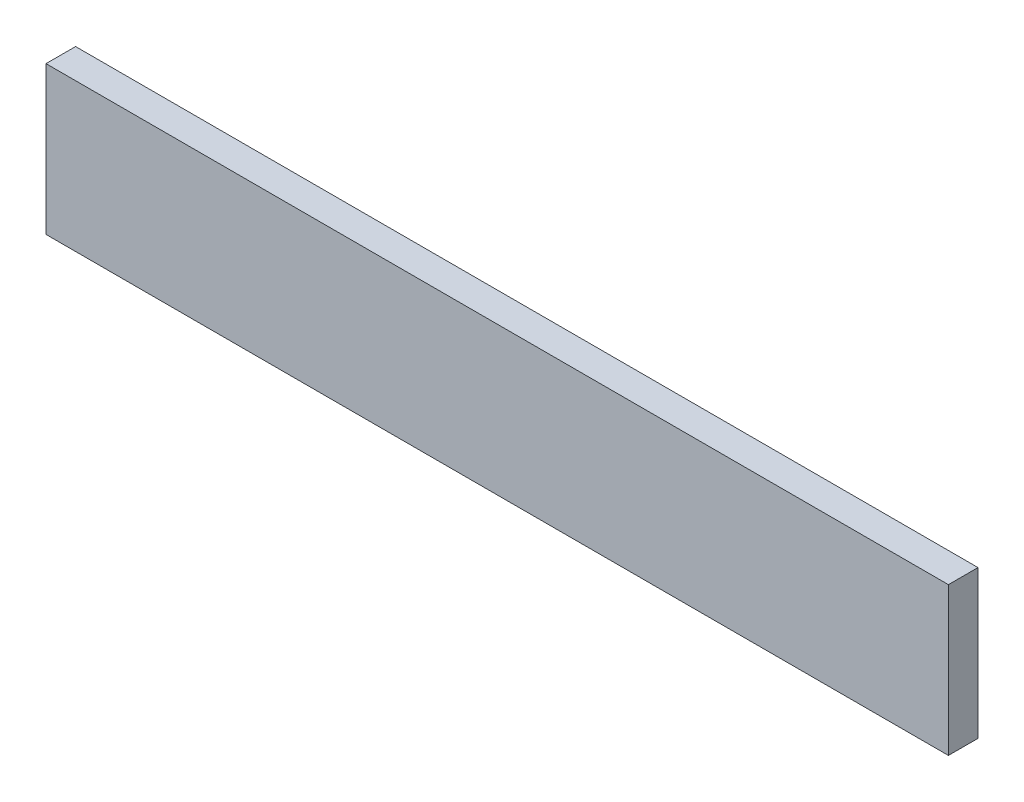
from build123d import *

# Parameters (mm, degrees)
IZIM1_W            = 610
IZIM1_H            = 100
TABAN_FLAN_1_DEPTH = 20


# Sheet-metal steps are written as plain solids
with BuildPart() as part:
    # Çizim1 → Taban-Flanş1 (new body)
    with BuildSketch(Plane.XY):
        with Locations((305, 50)):
            Rectangle(IZIM1_W, IZIM1_H)
    extrude(amount=-TABAN_FLAN_1_DEPTH)


solid = part.part
